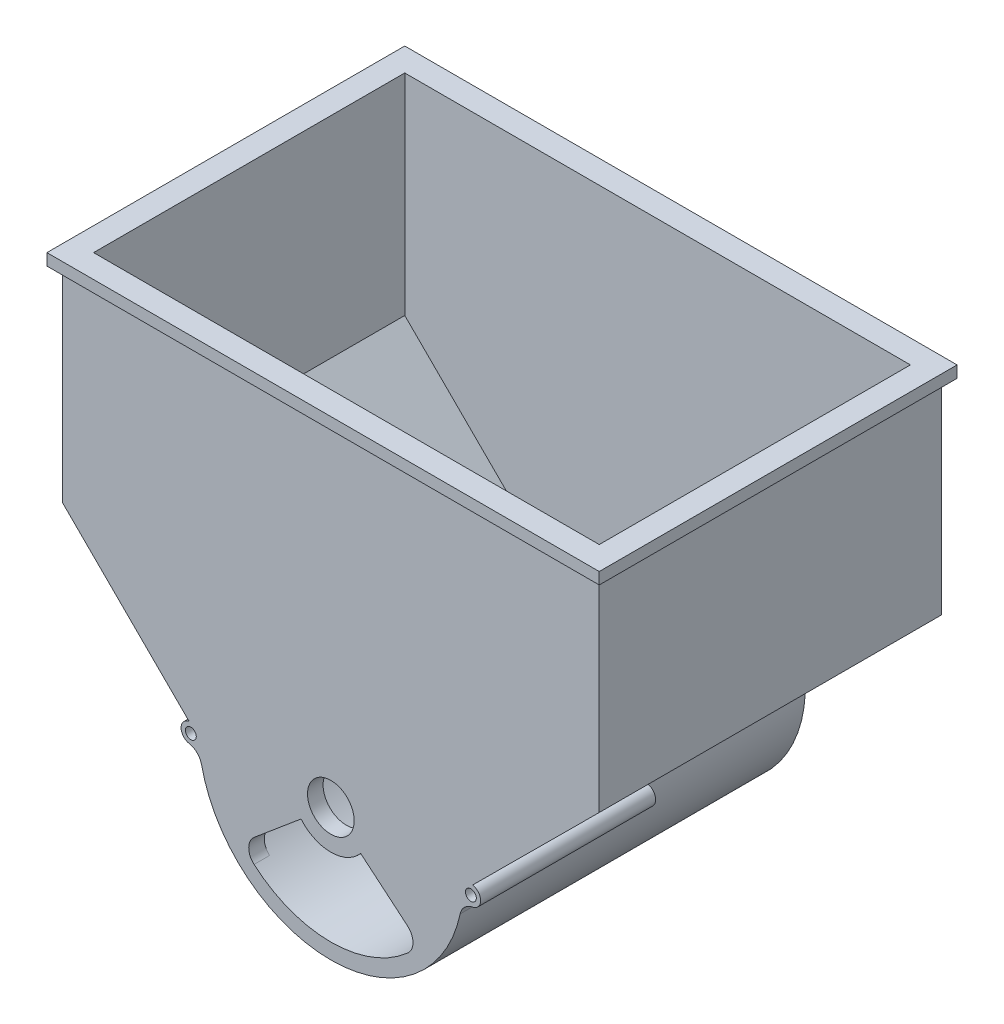
from build123d import *

# Parameters (mm, degrees)
EXTRUDE_1_DEPTH             = 80
EXTRUDE_2_DEPTH             = 4
EXTRUDE_START               = 4
EXTRUDE_3_DEPTH             = 4
CUT_EXTRUDE_1_DEPTH         = 4
CUT_EXTRUDE_2_REACH         = 176.531
SKETCH_5_R                  = 6.0000000000000036
CUT_EXTRUDE_START           = -4
CUT_EXTRUDE_3_DEPTH         = 4
SKETCH_7_R                  = 21
EXTRUDE_4_DEPTH             = 1
CUT_EXTRUDE_5_REACH         = 177.037
SKETCH_9_R                  = 4.599999999999999
SKETCH_9_R_2                = 1.3500000000000065
EXTRUDE_5_REACH             = 130.756
EXTRUDE_5_DIRECTION_2_REACH = 130.756
SKETCH_12_W                 = 138
SKETCH_12_H                 = 88
EXTRUDE_6_DEPTH             = 3
CHAMFER_1_SIZE              = 1
SKETCH_13_R                 = 2.5000000000000027
SKETCH_13_R_2               = 1.3999999999999955
SKETCH_13_R_3               = 2.5000000000000244
SKETCH_13_R_4               = 1.4000000000000308
EXTRUDE_7_DEPTH             = 45
FILLET_1_R                  = 4
FILLET_2_R                  = 4


with BuildPart() as part:
    # 草圖1 → 填料-伸長1 (new body)
    with BuildSketch(Plane.XY):
        with BuildLine():
            Line((-4, -1.6620202496294076), (-4, 54.00000000000001))
            Line((-4, 54.00000000000001), (134, 54.00000000000001))
            Line((134, 54.00000000000001), (134, -1.662020249629414))
            Line((134, -1.662020249629414), (98.96497064934022, -36.54297400803102))
            ThreePointArc((98.96497064934022, -36.54297400803102), (65.00000000000001, -69), (31.035029350659826, -36.54297400803101))
            Line((31.035029350659826, -36.54297400803101), (-4, -1.6620202496294076))
        make_face()
        with BuildLine():
            Line((0, 0), (0, 50))
            Line((0, 50), (130, 50))
            Line((130, 50), (130, 0))
            Line((130, 0), (94.99960713766303, -34.8464695929839))
            ThreePointArc((94.99960713766303, -34.8464695929839), (65.00000000000001, -65), (35.000392862337, -34.84646959298392))
            Line((35.000392862337, -34.84646959298392), (0, 0))
        make_face(mode=Mode.SUBTRACT)
    extrude(amount=EXTRUDE_1_DEPTH)

    # 草圖2 → 填料-伸長2 (add)
    # profile 1 of 2: a face of its own
    with BuildSketch(Plane.XY.offset(80)):
        with BuildLine():
            Line((-4, 54.00000000000001), (-4, -1.6620202496294076))
            Line((-4, -1.6620202496294076), (31.03502935065982, -36.54297400803101))
            ThreePointArc((31.03502935065982, -36.54297400803101), (65.00000000000001, -69), (98.96497064934022, -36.54297400803102))
            Line((98.96497064934022, -36.54297400803102), (134, -1.662020249629414))
            Line((134, -1.662020249629414), (134, 54.00000000000001))
            Line((134, 54.00000000000001), (-4, 54.00000000000001))
        make_face()
        with BuildLine():
            Line((130, 0), (94.99960713766303, -34.8464695929839))
            ThreePointArc((94.99960713766303, -34.8464695929839), (65.00000000000003, -65), (35.000392862337, -34.84646959298392))
            Line((35.000392862337, -34.84646959298392), (0, 0))
            Line((0, 0), (0, 50))
            Line((0, 50), (130, 50))
            Line((130, 50), (130, 0))
        make_face(mode=Mode.SUBTRACT)
    # profile 2 of 2: a face of its own
    with BuildSketch(Plane.XY.offset(80)):
        with BuildLine():
            ThreePointArc((94.99960713766303, -34.8464695929839), (65.00000000000003, -65), (35.000392862337, -34.84646959298392))
            Line((35.000392862337, -34.84646959298392), (0, 0))
            Line((0, 0), (0, 50))
            Line((0, 50), (130, 50))
            Line((130, 50), (130, 0))
            Line((130, 0), (94.99960713766303, -34.8464695929839))
        make_face()
    extrude(amount=EXTRUDE_2_DEPTH)

    # 草圖3 → 填料-伸長3 (add)
    with BuildSketch(Plane(origin=(0, 0, 0), x_dir=(-1, 0, 0), z_dir=(0, 0, -1)).offset(EXTRUDE_START)):
        with BuildLine():
            Line((-134, 54.00000000000001), (-134, -1.662020249629414))
            Line((-134, -1.662020249629414), (-98.9649706493402, -36.54297400803101))
            ThreePointArc((-98.9649706493402, -36.54297400803101), (-65.00000000000001, -69), (-31.03502935065982, -36.54297400803101))
            Line((-31.03502935065982, -36.54297400803101), (4, -1.6620202496294076))
            Line((4, -1.6620202496294076), (4, 54.00000000000001))
            Line((4, 54.00000000000001), (-134, 54.00000000000001))
        make_face()
    extrude(amount=-EXTRUDE_3_DEPTH)

    # 草圖4 → 除料-伸長1 (cut)
    with BuildSketch(Plane(origin=(0, 54.00000000000001, 0), x_dir=(1, 0, 0), z_dir=(0, 1, 0))):
        Polygon((0, 1.73e-15), (130, 0), (130, -80), (1.029e-14, -80), align=None)
    extrude(amount=-CUT_EXTRUDE_1_DEPTH, mode=Mode.SUBTRACT)

    # 除料-伸長2: up to this face of the body (flat: up to its plane)
    cut_extrude_2_end = Plane(part.part.faces().sort_by_distance((65, 4.120950098, -4))[0])
    # 草圖5 → 除料-伸長2 (cut, up to the picked face)
    with BuildSketch(Plane.XY.offset(84), mode=Mode.PRIVATE) as cut_extrude_2_sk1:
        with Locations((65.00000000000001, -35)):
            Circle(SKETCH_5_R)
    cut_extrude_2_tool1 = split(extrude(cut_extrude_2_sk1.sketch, amount=-CUT_EXTRUDE_2_REACH, mode=Mode.PRIVATE), bisect_by=cut_extrude_2_end, keep=Keep.BOTH, mode=Mode.PRIVATE)
    add(cut_extrude_2_tool1.solids().sort_by(Axis((65, -35, 84), (0, 0, -1)))[0], mode=Mode.SUBTRACT)

    # 草圖6 → 除料-伸長3 (cut)
    with BuildSketch(Plane.XY.offset(84).offset(CUT_EXTRUDE_START)):
        with BuildLine():
            ThreePointArc((64.99999999999967, -45), (60.77381738259285, -44.06307787036642), (57.33955556881022, -41.427876096865376))
            Line((57.339555568810226, -41.42787609686538), (42.01866670643064, -54.28362829059615))
            ThreePointArc((42.01866670643065, -54.28362829059614), (52.32145214777887, -62.18923361109942), (64.99999999999969, -65))
            Line((65.00000000000004, -65), (65.00000000000003, -45.00000000000001))
        make_face()
        with BuildLine():
            Line((87.9813332935694, -54.28362829059614), (72.66044443118982, -41.427876096865376))
            ThreePointArc((72.66044443118982, -41.427876096865376), (69.22618261740686, -44.06307787036657), (64.99999999999967, -45))
            Line((65.00000000000003, -45.00000000000001), (65.00000000000004, -65))
            ThreePointArc((64.99999999999969, -65), (77.67854785222087, -62.18923361109955), (87.9813332935694, -54.28362829059614))
        make_face()
    extrude(amount=CUT_EXTRUDE_3_DEPTH, mode=Mode.SUBTRACT)

    # 草圖7 → 填料-伸長4 (add)
    with BuildSketch(Plane(origin=(0, 0, -4), x_dir=(-1, 0, 0), z_dir=(0, 0, -1))):
        with Locations((-65.00000000000001, -43)):
            Circle(SKETCH_7_R)
    extrude(amount=EXTRUDE_4_DEPTH)

    # 草圖9 → 除料-伸長5 (cut, up to next)
    with BuildSketch(Plane(origin=(0, 0, -5), x_dir=(-1, 0, 0), z_dir=(0, 0, -1)), mode=Mode.PRIVATE) as cut_extrude_5_sk1:
        with Locations((-65.00000000000001, -35)):
            Circle(SKETCH_9_R)
    cut_extrude_5_tool1 = extrude(cut_extrude_5_sk1.sketch, amount=-CUT_EXTRUDE_5_REACH, mode=Mode.PRIVATE) & part.part
    # 草圖9 → 除料-伸長5 (cut, up to next)
    with BuildSketch(Plane(origin=(0, 0, -5), x_dir=(-1, 0, 0), z_dir=(0, 0, -1)), mode=Mode.PRIVATE) as cut_extrude_5_sk2:
        with Locations((-82.50000000000001, -43)):
            Circle(SKETCH_9_R_2)
    cut_extrude_5_tool2 = extrude(cut_extrude_5_sk2.sketch, amount=-CUT_EXTRUDE_5_REACH, mode=Mode.PRIVATE) & part.part
    # 草圖9 → 除料-伸長5 (cut, up to next)
    with BuildSketch(Plane(origin=(0, 0, -5), x_dir=(-1, 0, 0), z_dir=(0, 0, -1)), mode=Mode.PRIVATE) as cut_extrude_5_sk3:
        with Locations((-47.50000000000001, -43)):
            Circle(SKETCH_9_R_2)
    cut_extrude_5_tool3 = extrude(cut_extrude_5_sk3.sketch, amount=-CUT_EXTRUDE_5_REACH, mode=Mode.PRIVATE) & part.part
    add(cut_extrude_5_tool1.solids().sort_by_distance((65, -35, -5))[0], mode=Mode.SUBTRACT)
    add(cut_extrude_5_tool2.solids().sort_by_distance((82.5, -43, -5))[0], mode=Mode.SUBTRACT)
    add(cut_extrude_5_tool3.solids().sort_by_distance((47.5, -43, -5))[0], mode=Mode.SUBTRACT)

    # 填料-伸長5: up to this face of the body (flat: up to its plane)
    extrude_5_end = Plane(part.part.faces().sort_by_distance((130, 27, 40))[0])
    # 草圖10 → 填料-伸長5 (add, up to the picked face)
    with BuildSketch(Plane(origin=(65, 0, 0), x_dir=(0, 0, -1), z_dir=(1, 0, 0)), mode=Mode.PRIVATE) as extrude_5_sk1:
        Polygon((-83, 26.160223806036317), (-60.34563272960637, 1.0000000000000073), (-59.00000000000001, 1.0000000000000078), (-84, 28.765312870730142), (-84, 1.0000000000000044), (-83, 1.0000000000000044), align=None)
    extrude_5_tool1 = split(extrude(extrude_5_sk1.sketch, amount=EXTRUDE_5_REACH, mode=Mode.PRIVATE), bisect_by=extrude_5_end, keep=Keep.BOTH, mode=Mode.PRIVATE)
    add(extrude_5_tool1.solids().sort_by(Axis((65, 13.830112, 71.395163), (1, 0, 0)))[0])

    # 填料-伸長5 direction 2: up to this face of the body (flat: up to its plane)
    extrude_5_direction_2_end = Plane(part.part.faces().sort_by_distance((0, 27, 40))[0])
    # 草圖10 → 填料-伸長5 direction 2 (add, up to the picked face)
    with BuildSketch(Plane(origin=(65, 0, 0), x_dir=(0, 0, -1), z_dir=(1, 0, 0)), mode=Mode.PRIVATE) as extrude_5_direction_2_sk1:
        Polygon((-83, 26.160223806036317), (-60.34563272960637, 1.0000000000000073), (-59.00000000000001, 1.0000000000000078), (-84, 28.765312870730142), (-84, 1.0000000000000044), (-83, 1.0000000000000044), align=None)
    extrude_5_direction_2_tool1 = split(extrude(extrude_5_direction_2_sk1.sketch, amount=-EXTRUDE_5_DIRECTION_2_REACH, mode=Mode.PRIVATE), bisect_by=extrude_5_direction_2_end, keep=Keep.BOTH, mode=Mode.PRIVATE)
    add(extrude_5_direction_2_tool1.solids().sort_by(Axis((65, 13.830112, 71.395163), (-1, 0, 0)))[0])

    # 草圖12 → 填料-伸長6 (add)
    with BuildSketch(Plane(origin=(0, 54.00000000000001, 0), x_dir=(1, 0, 0), z_dir=(0, 1, 0))):
        Polygon((-6, 6), (136, 6), (136, -86), (-5.9999999999999885, -86), align=None)
        with Locations((65, -40)):
            Rectangle(SKETCH_12_W, SKETCH_12_H, mode=Mode.SUBTRACT)
    extrude(amount=-EXTRUDE_6_DEPTH)

    # 導角1
    chamfer_1_edges = [part.edges().sort_by_distance(p)[0] for p in [
        (86.00000000000001, -43, -4),
    ]]
    chamfer(chamfer_1_edges, length=CHAMFER_1_SIZE - 0.0001)  # a hair under: the kernel refuses the full size

    # 草圖13 → 填料-伸長7 (add)
    # profile 1 of 2: a face of its own
    with BuildSketch(Plane.XY.offset(84)):
        with Locations((29.000000000000018, -36.54297400803102)):
            Circle(SKETCH_13_R)
        with Locations((29.000000000000018, -36.54297400803102)):
            Circle(SKETCH_13_R_2, mode=Mode.SUBTRACT)
    # profile 2 of 2: a face of its own
    with BuildSketch(Plane.XY.offset(84)):
        with Locations((101, -36.54297400803102)):
            Circle(SKETCH_13_R_3)
        with Locations((101, -36.54297400803102)):
            Circle(SKETCH_13_R_4, mode=Mode.SUBTRACT)
    extrude(amount=-EXTRUDE_7_DEPTH)

    # 圓角1
    fillet_1_edges = [part.edges().sort_by_distance(p)[0] for p in [
        (42.01866670643065, -54.28362829059614, 82),
        (87.9813332935694, -54.28362829059614, 82),
    ]]
    fillet(fillet_1_edges, radius=FILLET_1_R)

    # 圓角2
    fillet_2_edges = [part.edges().sort_by_distance(p)[0] for p in [
        (31.121034817860412, -37.86630741327102, 61.5),
        (98.87896518213962, -37.86630741327102, 61.5),
    ]]
    fillet(fillet_2_edges, radius=FILLET_2_R)


solid = part.part
